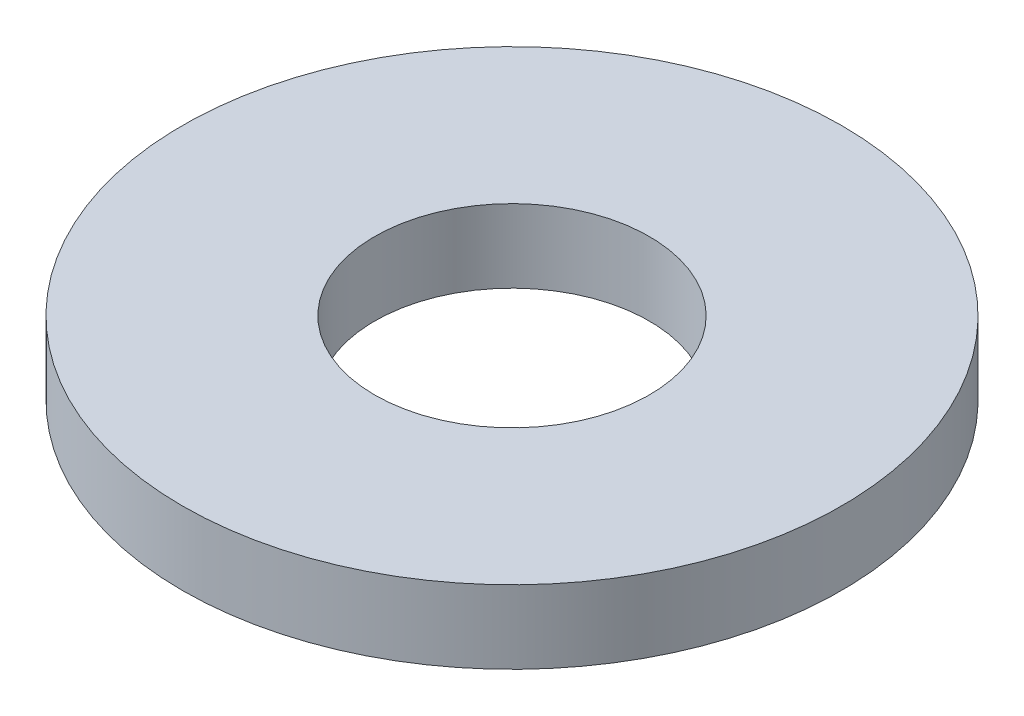
from build123d import *

# Parameters (mm, degrees)
SKETCH1_R           = 90
BOSS_EXTRUDE1_DEPTH = 20
SKETCH2_R           = 37.5
CUT_EXTRUDE1_DEPTH  = 129.840987267


with BuildPart() as part:
    # Sketch1 → Boss-Extrude1 (new body)
    with BuildSketch(Plane(origin=(0, 0, 0), x_dir=(1, 0, 0), z_dir=(0, 1, 0))):
        Circle(SKETCH1_R)
    extrude(amount=BOSS_EXTRUDE1_DEPTH)

    # Sketch2 → Cut-Extrude1 (cut, through all)
    with BuildSketch(Plane(origin=(0, 0, 0), x_dir=(1, 0, 0), z_dir=(0, 1, 0))):
        Circle(SKETCH2_R)
    extrude(amount=CUT_EXTRUDE1_DEPTH, mode=Mode.SUBTRACT)


solid = part.part
